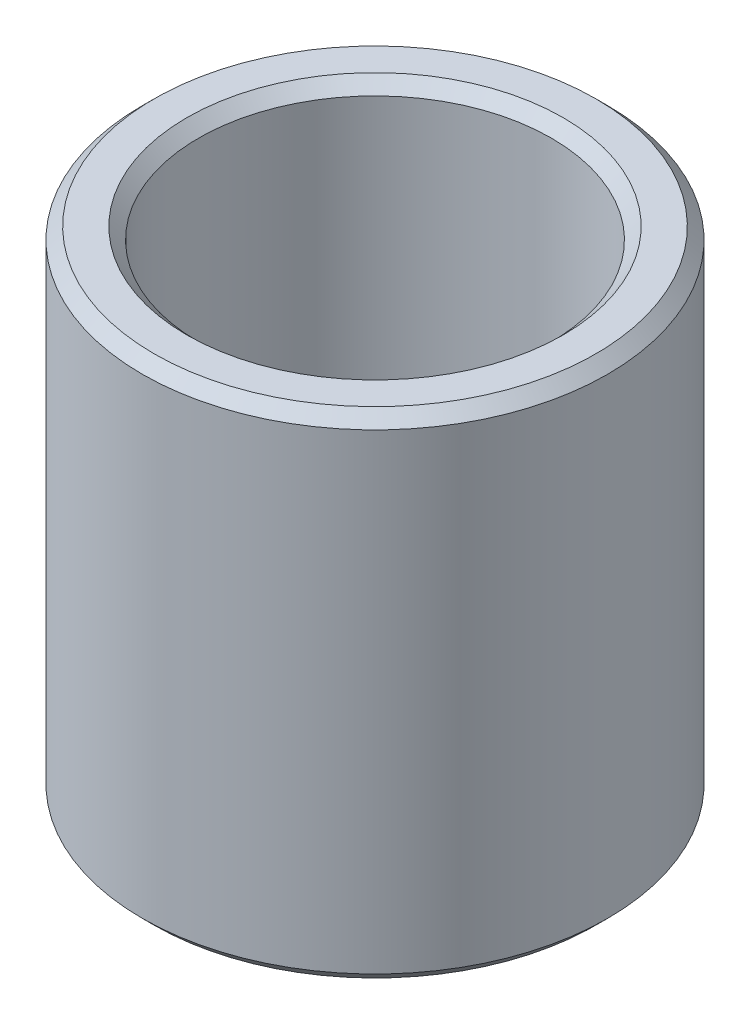
from build123d import *

# Parameters (mm, degrees)
SKETCH1_R           = 37.5
BOSS_EXTRUDE1_DEPTH = 79.751712055
SKETCH2_R           = 28.432329097
CUT_EXTRUDE1_DEPTH  = 96.774921434
CHAMFER1_SIZE       = 1.901703297


with BuildPart() as part:
    # Sketch1 → Boss-Extrude1 (new body)
    with BuildSketch(Plane(origin=(0, 0, 0), x_dir=(1, 0, 0), z_dir=(0, 1, 0))):
        Circle(SKETCH1_R)
    extrude(amount=BOSS_EXTRUDE1_DEPTH)

    # Sketch2 → Cut-Extrude1 (cut, through all)
    with BuildSketch(Plane(origin=(0, 0, 0), x_dir=(1, 0, 0), z_dir=(0, 1, 0))):
        Circle(SKETCH2_R)
    extrude(amount=CUT_EXTRUDE1_DEPTH, mode=Mode.SUBTRACT)

    # Chamfer1
    chamfer1_edges = [part.edges().sort_by_distance(p)[0] for p in [
        (-28.432329097, 79.751712055, 0),
        (-28.432329097, 0, 0),
        (-37.5, 0, 0),
        (-37.5, 79.751712055, 0),
    ]]
    chamfer(chamfer1_edges, length=CHAMFER1_SIZE)


solid = part.part
